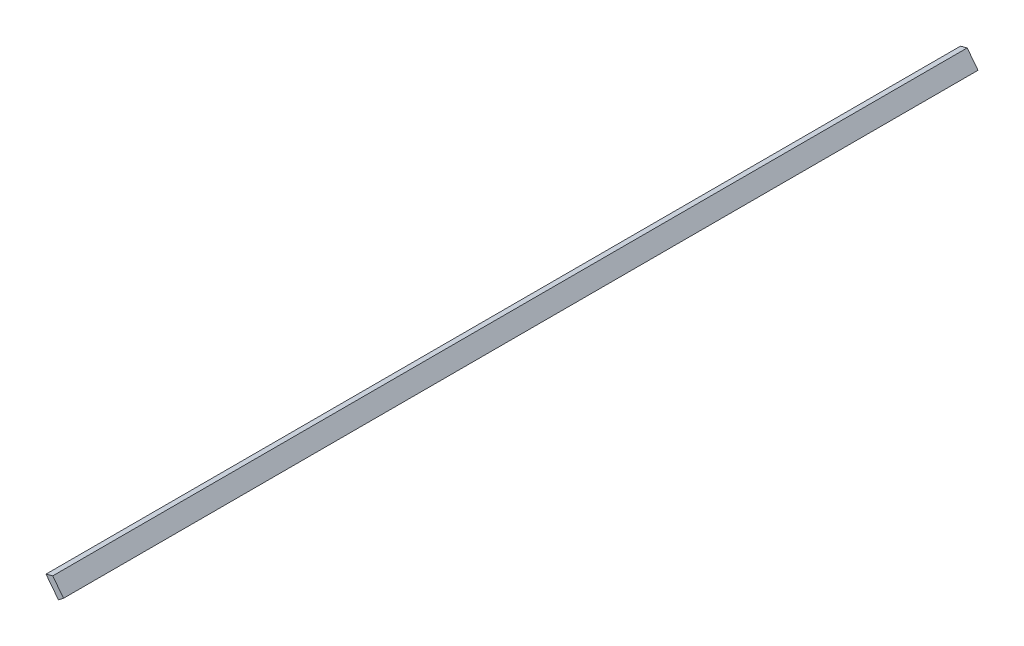
from build123d import *

# Parameters (mm, degrees)
BOSS_EXTRUDE1_DEPTH = 901.7


with BuildPart() as part:
    # Sketch1 → Boss-Extrude1 (new body)
    with BuildSketch(Plane.XY):
        Polygon((0, 0), (5.024531297, 3.88285787), (-5.636967182, 17.679147762), (-12.26983087, 15.8775189), align=None)
    extrude(amount=BOSS_EXTRUDE1_DEPTH)


solid = part.part
